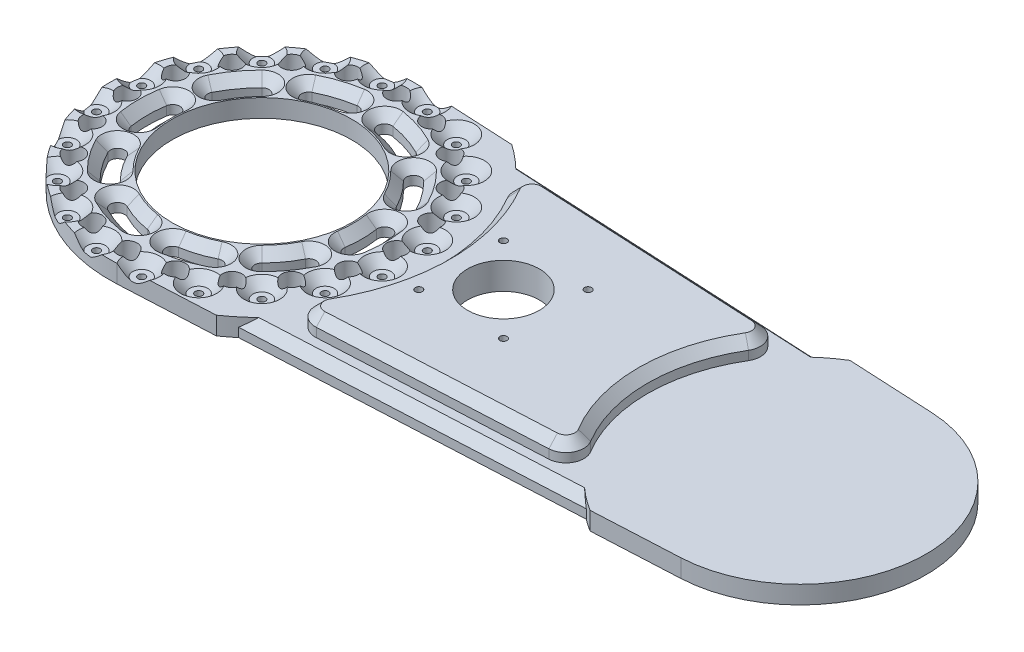
from build123d import *

# Parameters (mm, degrees)
BOSS_EXTRUDE3_OUTLINE_R   = 2
BOSS_EXTRUDE3_OUTLINE_R_2 = 5.5
BOSS_EXTRUDE3_OUTLINE_R_3 = 50
BOSS_EXTRUDE3_DEPTH       = 10
CUT_EXTRUDE1_DEPTH        = 10
SKETCH4_R                 = 5
CUT_EXTRUDE2_DEPTH        = 5
CHAMFER2_SIZE             = 5
SKETCH7_R                 = 2.000000006
SKETCH7_R_2               = 2.000000003
SKETCH7_R_3               = 2.000000005
SKETCH7_R_4               = 2.000000007
CUT_EXTRUDE4_DEPTH        = 15.5
CUT_EXTRUDE6_DEPTH        = 5
BOSS_EXTRUDE5_START       = 10
SKETCH10_R                = 20.000000001
SKETCH10_R_2              = 2.000000007
SKETCH10_R_3              = 2.000000006
SKETCH10_R_4              = 2.000000003
SKETCH10_R_5              = 2.000000005
BOSS_EXTRUDE5_DEPTH       = 10
CHAMFER3_SIZE             = 5
CUT_EXTRUDE7_DEPTH        = 10
CHAMFER5_SIZE             = 5


# Read off the part's stored shape, not the designer's step: Boss-Extrude3
with BuildPart() as part:
    # Boss-Extrude3 outline → Boss-Extrude3 (new body)
    with BuildSketch(Plane(origin=(0, 0, 0), x_dir=(1, 0, 0), z_dir=(0, 1, 0))):
        with BuildLine():
            ThreePointArc((303.24621879, -69.899132428), (369.740150323, 0.016046759), (303.240150389, 69.925453996))
            Line((303.240150389, 69.925453996), (4.25, 84.893683511))
            ThreePointArc((4.25, 84.893683511), (-84.99999992, -0.003689008), (4.257368772, -84.89331429))
            Line((4.257368772, -84.89331429), (303.24621879, -69.899132428))
        make_face()
        with Locations((-36.543122278, -71.72761124)):
            Circle(BOSS_EXTRUDE3_OUTLINE_R, mode=Mode.SUBTRACT)
        with Locations((-12.589523729, -79.509457879)):
            Circle(BOSS_EXTRUDE3_OUTLINE_R, mode=Mode.SUBTRACT)
        with Locations((0, -75)):
            Circle(BOSS_EXTRUDE3_OUTLINE_R_2, mode=Mode.SUBTRACT)
        with Locations((12.596425118, -79.508364807)):
            Circle(BOSS_EXTRUDE3_OUTLINE_R, mode=Mode.SUBTRACT)
        with Locations((-23.176274578, -71.329238722)):
            Circle(BOSS_EXTRUDE3_OUTLINE_R_2, mode=Mode.SUBTRACT)
        with Locations((23.176274578, -71.329238722)):
            Circle(BOSS_EXTRUDE3_OUTLINE_R_2, mode=Mode.SUBTRACT)
        with Locations((-56.919625407, -56.924566256)):
            Circle(BOSS_EXTRUDE3_OUTLINE_R, mode=Mode.SUBTRACT)
        with Locations((-44.083893922, -60.676274578)):
            Circle(BOSS_EXTRUDE3_OUTLINE_R_2, mode=Mode.SUBTRACT)
        with Locations((-60.676274578, -44.083893922)):
            Circle(BOSS_EXTRUDE3_OUTLINE_R_2, mode=Mode.SUBTRACT)
        with Locations((36.549348111, -71.724439019)):
            Circle(BOSS_EXTRUDE3_OUTLINE_R, mode=Mode.SUBTRACT)
        with Locations((44.083893922, -60.676274578)):
            Circle(BOSS_EXTRUDE3_OUTLINE_R_2, mode=Mode.SUBTRACT)
        with Locations((56.924566256, -56.919625407)):
            Circle(BOSS_EXTRUDE3_OUTLINE_R, mode=Mode.SUBTRACT)
        with Locations((60.676274578, -44.083893922)):
            Circle(BOSS_EXTRUDE3_OUTLINE_R_2, mode=Mode.SUBTRACT)
        with Locations((-71.724439019, -36.549348111)):
            Circle(BOSS_EXTRUDE3_OUTLINE_R, mode=Mode.SUBTRACT)
        with Locations((-71.329238722, -23.176274578)):
            Circle(BOSS_EXTRUDE3_OUTLINE_R_2, mode=Mode.SUBTRACT)
        with Locations((-79.508364807, -12.596425118)):
            Circle(BOSS_EXTRUDE3_OUTLINE_R, mode=Mode.SUBTRACT)
        with Locations((-75, 0)):
            Circle(BOSS_EXTRUDE3_OUTLINE_R_2, mode=Mode.SUBTRACT)
        Circle(BOSS_EXTRUDE3_OUTLINE_R_3, mode=Mode.SUBTRACT)
        with Locations((71.72761124, -36.543122278)):
            Circle(BOSS_EXTRUDE3_OUTLINE_R, mode=Mode.SUBTRACT)
        with Locations((71.329238722, -23.176274578)):
            Circle(BOSS_EXTRUDE3_OUTLINE_R_2, mode=Mode.SUBTRACT)
        with Locations((79.509457879, -12.589523729)):
            Circle(BOSS_EXTRUDE3_OUTLINE_R, mode=Mode.SUBTRACT)
        with Locations((75, 0)):
            Circle(BOSS_EXTRUDE3_OUTLINE_R_2, mode=Mode.SUBTRACT)
        with Locations((-79.509457879, 12.589523729)):
            Circle(BOSS_EXTRUDE3_OUTLINE_R, mode=Mode.SUBTRACT)
        with Locations((-71.329238722, 23.176274578)):
            Circle(BOSS_EXTRUDE3_OUTLINE_R_2, mode=Mode.SUBTRACT)
        with Locations((-71.72761124, 36.543122278)):
            Circle(BOSS_EXTRUDE3_OUTLINE_R, mode=Mode.SUBTRACT)
        with Locations((79.508364807, 12.596425118)):
            Circle(BOSS_EXTRUDE3_OUTLINE_R, mode=Mode.SUBTRACT)
        with Locations((71.329238722, 23.176274578)):
            Circle(BOSS_EXTRUDE3_OUTLINE_R_2, mode=Mode.SUBTRACT)
        with Locations((71.724439019, 36.549348111)):
            Circle(BOSS_EXTRUDE3_OUTLINE_R, mode=Mode.SUBTRACT)
        with Locations((-60.676274578, 44.083893922)):
            Circle(BOSS_EXTRUDE3_OUTLINE_R_2, mode=Mode.SUBTRACT)
        with Locations((-56.924566256, 56.919625407)):
            Circle(BOSS_EXTRUDE3_OUTLINE_R, mode=Mode.SUBTRACT)
        with Locations((-44.083893922, 60.676274578)):
            Circle(BOSS_EXTRUDE3_OUTLINE_R_2, mode=Mode.SUBTRACT)
        with Locations((-36.549348111, 71.724439019)):
            Circle(BOSS_EXTRUDE3_OUTLINE_R, mode=Mode.SUBTRACT)
        with Locations((-23.176274578, 71.329238722)):
            Circle(BOSS_EXTRUDE3_OUTLINE_R_2, mode=Mode.SUBTRACT)
        with Locations((23.176274578, 71.329238722)):
            Circle(BOSS_EXTRUDE3_OUTLINE_R_2, mode=Mode.SUBTRACT)
        with Locations((0, 75)):
            Circle(BOSS_EXTRUDE3_OUTLINE_R_2, mode=Mode.SUBTRACT)
        with Locations((-12.596425118, 79.508364807)):
            Circle(BOSS_EXTRUDE3_OUTLINE_R, mode=Mode.SUBTRACT)
        with Locations((12.589523729, 79.509457879)):
            Circle(BOSS_EXTRUDE3_OUTLINE_R, mode=Mode.SUBTRACT)
        with Locations((60.676274578, 44.083893922)):
            Circle(BOSS_EXTRUDE3_OUTLINE_R_2, mode=Mode.SUBTRACT)
        with Locations((56.919625407, 56.924566256)):
            Circle(BOSS_EXTRUDE3_OUTLINE_R, mode=Mode.SUBTRACT)
        with Locations((44.083893922, 60.676274578)):
            Circle(BOSS_EXTRUDE3_OUTLINE_R_2, mode=Mode.SUBTRACT)
        with Locations((36.543122278, 71.72761124)):
            Circle(BOSS_EXTRUDE3_OUTLINE_R, mode=Mode.SUBTRACT)
    extrude(amount=BOSS_EXTRUDE3_DEPTH)

    # Sketch3 → Cut-Extrude1 (cut)
    with BuildSketch(Plane(origin=(0, 10, 0), x_dir=(1, 0, 0), z_dir=(0, 1, 0))):
        with BuildLine():
            ThreePointArc((62.96556447, -9.969964444), (63.74999994, 0.002766756), (62.964698838, 9.97542983))
            ThreePointArc((62.964698838, 9.97542983), (58.388063313, 13.300246709), (55.063246434, 8.723611184))
            ThreePointArc((55.063246434, 8.723611184), (55.749999947, 0.002419555), (55.064003438, -8.718831651))
            ThreePointArc((55.064003438, -8.718831651), (58.389217557, -13.295178563), (62.96556447, -9.969964444))
        make_face()
        with BuildLine():
            ThreePointArc((56.800409782, 28.944359529), (51.573207084, 37.473548151), (45.076100866, 45.08001365))
            ThreePointArc((45.076100866, 45.08001365), (39.419246622, 45.079768142), (39.41949213, 39.422913898))
            ThreePointArc((39.41949213, 39.422913898), (45.101275215, 32.770985246), (49.672515222, 25.312126176))
            ThreePointArc((49.672515222, 25.312126176), (55.052579178, 23.564295572), (56.800409782, 28.944359529))
        make_face()
        with BuildLine():
            ThreePointArc((-9.97542983, 62.964698838), (-19.702464714, 60.628997882), (-28.944359529, 56.800409782))
            ThreePointArc((-28.944359529, 56.800409782), (-30.692190133, 51.420345826), (-25.312126176, 49.672515222))
            ThreePointArc((-25.312126176, 49.672515222), (-17.229998554, 53.02065305), (-8.723611184, 55.063246434))
            ThreePointArc((-8.723611184, 55.063246434), (-5.398794306, 59.639881959), (-9.97542983, 62.964698838))
        make_face()
        with BuildLine():
            ThreePointArc((45.08001365, -45.076100866), (51.576459601, -37.469071446), (56.802921945, -28.939429133))
            ThreePointArc((56.802921945, -28.939429133), (55.054624356, -23.559516909), (49.674712132, -25.307814497))
            ThreePointArc((49.674712132, -25.307814497), (45.104119573, -32.767070323), (39.422913898, -39.41949213))
            ThreePointArc((39.422913898, -39.41949213), (39.423159406, -45.076346374), (45.08001365, -45.076100866))
        make_face()
        with BuildLine():
            ThreePointArc((28.939429133, 56.802921945), (19.697202031, 60.630707831), (9.969964444, 62.96556447))
            ThreePointArc((9.969964444, 62.96556447), (5.393617532, 59.64035035), (8.718831651, 55.064003438))
            ThreePointArc((8.718831651, 55.064003438), (17.225396286, 53.022148417), (25.307814497, 49.674712132))
            ThreePointArc((25.307814497, 49.674712132), (30.687726721, 51.42300972), (28.939429133, 56.802921945))
        make_face()
        with BuildLine():
            ThreePointArc((-62.964698838, -9.97542983), (-58.388063313, -13.300246709), (-55.063246434, -8.723611184))
            ThreePointArc((-55.063246434, -8.723611184), (-55.749999947, -0.002419555), (-55.064003438, 8.718831651))
            ThreePointArc((-55.064003438, 8.718831651), (-58.389217557, 13.295178563), (-62.96556447, 9.969964444))
            ThreePointArc((-62.96556447, 9.969964444), (-63.74999994, -0.002766756), (-62.964698838, -9.97542983))
        make_face()
        with BuildLine():
            ThreePointArc((-56.802921945, 28.939429133), (-55.054624356, 23.559516909), (-49.674712132, 25.307814497))
            ThreePointArc((-49.674712132, 25.307814497), (-45.104119573, 32.767070323), (-39.422913898, 39.41949213))
            ThreePointArc((-39.422913898, 39.41949213), (-39.423159406, 45.076346374), (-45.08001365, 45.076100866))
            ThreePointArc((-45.08001365, 45.076100866), (-51.576459601, 37.469071446), (-56.802921945, 28.939429133))
        make_face()
        with BuildLine():
            ThreePointArc((-45.076100866, -45.08001365), (-39.419246622, -45.079768142), (-39.41949213, -39.422913898))
            ThreePointArc((-39.41949213, -39.422913898), (-45.101275215, -32.770985246), (-49.672515222, -25.312126176))
            ThreePointArc((-49.672515222, -25.312126176), (-55.052579178, -23.564295572), (-56.800409782, -28.944359529))
            ThreePointArc((-56.800409782, -28.944359529), (-51.573207084, -37.473548151), (-45.076100866, -45.08001365))
        make_face()
        with BuildLine():
            ThreePointArc((-25.307814497, -49.674712132), (-30.687726721, -51.42300972), (-28.939429133, -56.802921945))
            ThreePointArc((-28.939429133, -56.802921945), (-19.697202031, -60.630707831), (-9.969964444, -62.96556447))
            ThreePointArc((-9.969964444, -62.96556447), (-5.393617532, -59.64035035), (-8.718831651, -55.064003438))
            ThreePointArc((-8.718831651, -55.064003438), (-17.225396286, -53.022148417), (-25.307814497, -49.674712132))
        make_face()
        with BuildLine():
            ThreePointArc((8.723611184, -55.063246434), (5.398794306, -59.639881959), (9.97542983, -62.964698838))
            ThreePointArc((9.97542983, -62.964698838), (19.702464714, -60.628997882), (28.944359529, -56.800409782))
            ThreePointArc((28.944359529, -56.800409782), (30.692190133, -51.420345826), (25.312126176, -49.672515222))
            ThreePointArc((25.312126176, -49.672515222), (17.229998554, -53.02065305), (8.723611184, -55.063246434))
        make_face()
    extrude(amount=-CUT_EXTRUDE1_DEPTH, mode=Mode.SUBTRACT)

    # Sketch4 → Cut-Extrude2 (cut)
    with BuildSketch(Plane(origin=(0, 10, 0), x_dir=(1, 0, 0), z_dir=(0, 1, 0))):
        with Locations((-79.508364807, -12.596425118)):
            Circle(SKETCH4_R)
        with Locations((-79.509457879, 12.589523729)):
            Circle(SKETCH4_R)
        with Locations((-71.72761124, 36.543122278)):
            Circle(SKETCH4_R)
        with Locations((-56.924566256, 56.919625407)):
            Circle(SKETCH4_R)
        with Locations((-36.549348111, 71.724439019)):
            Circle(SKETCH4_R)
        with Locations((-12.596425118, 79.508364807)):
            Circle(SKETCH4_R)
        with Locations((12.589523729, 79.509457879)):
            Circle(SKETCH4_R)
        with Locations(Location((36.543122278, 71.72761124, 0), (0, 0, 270))):
            Circle(SKETCH4_R)
        with Locations(Location((56.919625407, 56.924566256, 0), (0, 0, 270))):
            Circle(SKETCH4_R)
        with Locations(Location((71.724439019, 36.549348111, 0), (0, 0, 270))):
            Circle(SKETCH4_R)
        with Locations(Location((79.508364807, 12.596425118, 0), (0, 0, 270))):
            Circle(SKETCH4_R)
        with Locations(Location((79.509457879, -12.589523729, 0), (0, 0, 270))):
            Circle(SKETCH4_R)
        with Locations(Location((71.72761124, -36.543122278, 0), (0, 0, 270))):
            Circle(SKETCH4_R)
        with Locations(Location((56.924566256, -56.919625407, 0), (0, 0, 270))):
            Circle(SKETCH4_R)
        with Locations(Location((36.549348111, -71.724439019, 0), (0, 0, 270))):
            Circle(SKETCH4_R)
        with Locations((12.596425118, -79.508364807)):
            Circle(SKETCH4_R)
        with Locations((-12.589523729, -79.509457879)):
            Circle(SKETCH4_R)
        with Locations((-36.543122278, -71.72761124)):
            Circle(SKETCH4_R)
        with Locations((-56.919625407, -56.924566256)):
            Circle(SKETCH4_R)
        with Locations((-71.724439019, -36.549348111)):
            Circle(SKETCH4_R)
    extrude(amount=-CUT_EXTRUDE2_DEPTH, mode=Mode.SUBTRACT)

    # Chamfer2
    # the kernel refuses this chamfer: 5 mm, written as the material it takes off along each edge
    with BuildSketch(Plane(origin=(-59.013972636, 10, 9.349520507), x_dir=(-0.987681550393962, 0, 0.15647733066287803), z_dir=(-0.15647733066287803, 0, -0.987681550393962))) as chamfer2_piece_1:
        Polygon((4 + CHAMFER2_SIZE, 0), (4, -CHAMFER2_SIZE), (4, 0), align=None)
    revolve(axis=Axis((-59.013972636, 10, 9.349520507), (0, 1, 0)), revolution_arc=180, mode=Mode.SUBTRACT)
    with BuildSketch(Plane(origin=(0, 10, 0), x_dir=(-0.9876815503939634, 0, 0.156477330662869), z_dir=(0.156477330662869, 0, 0.9876815503939634))) as chamfer2_piece_2:
        Polygon((55.75 - CHAMFER2_SIZE, 0), (55.75, CHAMFER2_SIZE), (55.75, 0), align=None)
    revolve(axis=Axis((0, 10, 0), (0, -1, 0)), revolution_arc=18, mode=Mode.SUBTRACT)
    with BuildSketch(Plane(origin=(0, 10, 0), x_dir=(-0.9876951289359334, 0, -0.1563915991229388), z_dir=(0.1563915991229388, 0, -0.9876951289359334))) as chamfer2_piece_3:
        Polygon((63.75 + CHAMFER2_SIZE, 0), (63.75, -CHAMFER2_SIZE), (63.75, 0), align=None)
    revolve(axis=Axis((0, 10, 0), (0, 1, 0)), revolution_arc=18, mode=Mode.SUBTRACT)
    with BuildSketch(Plane(origin=(-59.014783954, 10, -9.344398048), x_dir=(0.9876951289359372, 0, 0.15639159912291412), z_dir=(-0.15639159912291412, 0, 0.9876951289359372))) as chamfer2_piece_4:
        Polygon((4 + CHAMFER2_SIZE, 0), (4, -CHAMFER2_SIZE), (4, 0), align=None)
    revolve(axis=Axis((-59.014783954, 10, -9.344398048), (0, 1, 0)), revolution_arc=180, mode=Mode.SUBTRACT)
    with BuildSketch(Plane(origin=(-42.247796498, 10, 42.251463774), x_dir=(-0.707076092017545, 0, 0.707137469023666), z_dir=(-0.707137469023666, 0, -0.707076092017545))) as chamfer2_piece_5:
        Polygon((4 + CHAMFER2_SIZE, 0), (4, -CHAMFER2_SIZE), (4, 0), align=None)
    revolve(axis=Axis((-42.247796498, 10, 42.251463774), (0, 1, 0)), revolution_arc=180, mode=Mode.SUBTRACT)
    with BuildSketch(Plane(origin=(0, 10, 0), x_dir=(-0.7070760920176004, 0, 0.7071374690236107), z_dir=(0.7071374690236107, 0, 0.7070760920176004))) as chamfer2_piece_6:
        Polygon((55.75 - CHAMFER2_SIZE, 0), (55.75, CHAMFER2_SIZE), (55.75, 0), align=None)
    revolve(axis=Axis((0, 10, 0), (0, -1, 0)), revolution_arc=18, mode=Mode.SUBTRACT)
    with BuildSketch(Plane(origin=(0, 10, 0), x_dir=(-0.8909868201174173, 0, 0.45402916908173774), z_dir=(-0.45402916908173774, 0, -0.8909868201174173))) as chamfer2_piece_7:
        Polygon((63.75 + CHAMFER2_SIZE, 0), (63.75, -CHAMFER2_SIZE), (63.75, 0), align=None)
    revolve(axis=Axis((0, 10, 0), (0, 1, 0)), revolution_arc=18, mode=Mode.SUBTRACT)
    with BuildSketch(Plane(origin=(-53.236462502, 10, 27.128242853), x_dir=(0.8909868201174534, 0, -0.4540291690816666), z_dir=(0.4540291690816666, 0, 0.8909868201174534))) as chamfer2_piece_8:
        Polygon((4 + CHAMFER2_SIZE, 0), (4, -CHAMFER2_SIZE), (4, 0), align=None)
    revolve(axis=Axis((-53.236462502, 10, 27.128242853), (0, 1, 0)), revolution_arc=180, mode=Mode.SUBTRACT)
    with BuildSketch(Plane(origin=(-9.344398048, 10, 59.014783954), x_dir=(-0.15639159912293782, 0, 0.9876951289359336), z_dir=(-0.9876951289359336, 0, -0.15639159912293782))) as chamfer2_piece_9:
        Polygon((4 + CHAMFER2_SIZE, 0), (4, -CHAMFER2_SIZE), (4, 0), align=None)
    revolve(axis=Axis((-9.344398048, 10, 59.014783954), (0, 1, 0)), revolution_arc=180, mode=Mode.SUBTRACT)
    with BuildSketch(Plane(origin=(0, 10, 0), x_dir=(-0.156391599122972, 0, 0.9876951289359281), z_dir=(0.9876951289359281, 0, 0.156391599122972))) as chamfer2_piece_10:
        Polygon((55.75 - CHAMFER2_SIZE, 0), (55.75, CHAMFER2_SIZE), (55.75, 0), align=None)
    revolve(axis=Axis((0, 10, 0), (0, -1, 0)), revolution_arc=18, mode=Mode.SUBTRACT)
    with BuildSketch(Plane(origin=(0, 10, 0), x_dir=(-0.45395182954222274, 0, 0.8910262265810523), z_dir=(-0.8910262265810523, 0, -0.45395182954222274))) as chamfer2_piece_11:
        Polygon((63.75 + CHAMFER2_SIZE, 0), (63.75, -CHAMFER2_SIZE), (63.75, 0), align=None)
    revolve(axis=Axis((0, 10, 0), (0, 1, 0)), revolution_arc=18, mode=Mode.SUBTRACT)
    with BuildSketch(Plane(origin=(-27.123621815, 10, 53.238817038), x_dir=(0.45395182954229385, 0, -0.891026226581016), z_dir=(0.891026226581016, 0, 0.45395182954229385))) as chamfer2_piece_12:
        Polygon((4 + CHAMFER2_SIZE, 0), (4, -CHAMFER2_SIZE), (4, 0), align=None)
    revolve(axis=Axis((-27.123621815, 10, 53.238817038), (0, 1, 0)), revolution_arc=180, mode=Mode.SUBTRACT)
    with BuildSketch(Plane(origin=(9.349520507, 10, 59.013972636), x_dir=(-0.1564773306628907, 0, -0.98768155039396), z_dir=(0.98768155039396, 0, -0.1564773306628907))) as chamfer2_piece_13:
        Polygon((4 + CHAMFER2_SIZE, 0), (4, -CHAMFER2_SIZE), (4, 0), align=None)
    revolve(axis=Axis((9.349520507, 10, 59.013972636), (0, 1, 0)), revolution_arc=180, mode=Mode.SUBTRACT)
    with BuildSketch(Plane(origin=(0, 10, 0), x_dir=(0.1564773306628972, 0, 0.9876815503939589), z_dir=(-0.9876815503939589, 0, 0.1564773306628972))) as chamfer2_piece_14:
        Polygon((63.75 + CHAMFER2_SIZE, 0), (63.75, -CHAMFER2_SIZE), (63.75, 0), align=None)
    revolve(axis=Axis((0, 10, 0), (0, 1, 0)), revolution_arc=18, mode=Mode.SUBTRACT)
    with BuildSketch(Plane(origin=(0, 10, 0), x_dir=(0.4540291690816931, 0, 0.89098682011744), z_dir=(0.89098682011744, 0, -0.4540291690816931))) as chamfer2_piece_15:
        Polygon((55.75 - CHAMFER2_SIZE, 0), (55.75, CHAMFER2_SIZE), (55.75, 0), align=None)
    revolve(axis=Axis((0, 10, 0), (0, -1, 0)), revolution_arc=18, mode=Mode.SUBTRACT)
    with BuildSketch(Plane(origin=(27.128242853, 10, 53.236462502), x_dir=(0.45402916908164603, 0, 0.890986820117464), z_dir=(-0.890986820117464, 0, 0.45402916908164603))) as chamfer2_piece_16:
        Polygon((4 + CHAMFER2_SIZE, 0), (4, -CHAMFER2_SIZE), (4, 0), align=None)
    revolve(axis=Axis((27.128242853, 10, 53.236462502), (0, 1, 0)), revolution_arc=180, mode=Mode.SUBTRACT)
    with BuildSketch(Plane(origin=(42.251463774, 10, 42.247796498), x_dir=(-0.7071374690237141, 0, -0.7070760920174971), z_dir=(0.7070760920174971, 0, -0.7071374690237141))) as chamfer2_piece_17:
        Polygon((4 + CHAMFER2_SIZE, 0), (4, -CHAMFER2_SIZE), (4, 0), align=None)
    revolve(axis=Axis((42.251463774, 10, 42.247796498), (0, 1, 0)), revolution_arc=180, mode=Mode.SUBTRACT)
    with BuildSketch(Plane(origin=(0, 10, 0), x_dir=(0.7071374690236412, 0, 0.7070760920175699), z_dir=(-0.7070760920175699, 0, 0.7071374690236412))) as chamfer2_piece_18:
        Polygon((63.75 + CHAMFER2_SIZE, 0), (63.75, -CHAMFER2_SIZE), (63.75, 0), align=None)
    revolve(axis=Axis((0, 10, 0), (0, 1, 0)), revolution_arc=18, mode=Mode.SUBTRACT)
    with BuildSketch(Plane(origin=(0, 10, 0), x_dir=(0.8910262265810269, 0, 0.4539518295422725), z_dir=(0.4539518295422725, 0, -0.8910262265810269))) as chamfer2_piece_19:
        Polygon((55.75 - CHAMFER2_SIZE, 0), (55.75, CHAMFER2_SIZE), (55.75, 0), align=None)
    revolve(axis=Axis((0, 10, 0), (0, -1, 0)), revolution_arc=18, mode=Mode.SUBTRACT)
    with BuildSketch(Plane(origin=(53.238817038, 10, 27.123621815), x_dir=(0.8910262265809425, 0, 0.4539518295424383), z_dir=(-0.4539518295424383, 0, 0.8910262265809425))) as chamfer2_piece_20:
        Polygon((4 + CHAMFER2_SIZE, 0), (4, -CHAMFER2_SIZE), (4, 0), align=None)
    revolve(axis=Axis((53.238817038, 10, 27.123621815), (0, 1, 0)), revolution_arc=180, mode=Mode.SUBTRACT)
    with BuildSketch(Plane(origin=(59.014783954, 10, 9.344398048), x_dir=(-0.9876951289359776, 0, -0.15639159912265974), z_dir=(0.15639159912265974, 0, -0.9876951289359776))) as chamfer2_piece_21:
        Polygon((4 + CHAMFER2_SIZE, 0), (4, -CHAMFER2_SIZE), (4, 0), align=None)
    revolve(axis=Axis((59.014783954, 10, 9.344398048), (0, 1, 0)), revolution_arc=180, mode=Mode.SUBTRACT)
    with BuildSketch(Plane(origin=(0, 10, 0), x_dir=(0.9876951289359344, 0, 0.15639159912293288), z_dir=(-0.15639159912293288, 0, 0.9876951289359344))) as chamfer2_piece_22:
        Polygon((63.75 + CHAMFER2_SIZE, 0), (63.75, -CHAMFER2_SIZE), (63.75, 0), align=None)
    revolve(axis=Axis((0, 10, 0), (0, 1, 0)), revolution_arc=18, mode=Mode.SUBTRACT)
    with BuildSketch(Plane(origin=(0, 10, 0), x_dir=(0.9876815503939652, 0, -0.15647733066285652), z_dir=(-0.15647733066285652, 0, -0.9876815503939652))) as chamfer2_piece_23:
        Polygon((55.75 - CHAMFER2_SIZE, 0), (55.75, CHAMFER2_SIZE), (55.75, 0), align=None)
    revolve(axis=Axis((0, 10, 0), (0, -1, 0)), revolution_arc=18, mode=Mode.SUBTRACT)
    with BuildSketch(Plane(origin=(59.013972636, 10, -9.349520507), x_dir=(0.9876815503940178, 0, -0.15647733066252528), z_dir=(0.15647733066252528, 0, 0.9876815503940178))) as chamfer2_piece_24:
        Polygon((4 + CHAMFER2_SIZE, 0), (4, -CHAMFER2_SIZE), (4, 0), align=None)
    revolve(axis=Axis((59.013972636, 10, -9.349520507), (0, 1, 0)), revolution_arc=180, mode=Mode.SUBTRACT)
    with BuildSketch(Plane(origin=(53.236462502, 10, -27.128242853), x_dir=(-0.8909868201172598, 0, 0.45402916908204666), z_dir=(-0.45402916908204666, 0, -0.8909868201172598))) as chamfer2_piece_25:
        Polygon((4 + CHAMFER2_SIZE, 0), (4, -CHAMFER2_SIZE), (4, 0), align=None)
    revolve(axis=Axis((53.236462502, 10, -27.128242853), (0, 1, 0)), revolution_arc=180, mode=Mode.SUBTRACT)
    with BuildSketch(Plane(origin=(0, 10, 0), x_dir=(0.8909868201174278, 0, -0.45402916908171703), z_dir=(0.45402916908171703, 0, 0.8909868201174278))) as chamfer2_piece_26:
        Polygon((63.75 + CHAMFER2_SIZE, 0), (63.75, -CHAMFER2_SIZE), (63.75, 0), align=None)
    revolve(axis=Axis((0, 10, 0), (0, 1, 0)), revolution_arc=18, mode=Mode.SUBTRACT)
    with BuildSketch(Plane(origin=(0, 10, 0), x_dir=(0.7070760920175798, 0, -0.7071374690236313), z_dir=(-0.7071374690236313, 0, -0.7070760920175798))) as chamfer2_piece_27:
        Polygon((55.75 - CHAMFER2_SIZE, 0), (55.75, CHAMFER2_SIZE), (55.75, 0), align=None)
    revolve(axis=Axis((0, 10, 0), (0, -1, 0)), revolution_arc=18, mode=Mode.SUBTRACT)
    with BuildSketch(Plane(origin=(42.247796498, 10, -42.251463774), x_dir=(0.7070760920178728, 0, -0.7071374690233384), z_dir=(0.7071374690233384, 0, 0.7070760920178728))) as chamfer2_piece_28:
        Polygon((4 + CHAMFER2_SIZE, 0), (4, -CHAMFER2_SIZE), (4, 0), align=None)
    revolve(axis=Axis((42.247796498, 10, -42.251463774), (0, 1, 0)), revolution_arc=180, mode=Mode.SUBTRACT)
    with BuildSketch(Plane(origin=(27.123621815, 10, -53.238817038), x_dir=(-0.45395182954191593, 0, 0.8910262265812087), z_dir=(-0.8910262265812087, 0, -0.45395182954191593))) as chamfer2_piece_29:
        Polygon((4 + CHAMFER2_SIZE, 0), (4, -CHAMFER2_SIZE), (4, 0), align=None)
    revolve(axis=Axis((27.123621815, 10, -53.238817038), (0, 1, 0)), revolution_arc=180, mode=Mode.SUBTRACT)
    with BuildSketch(Plane(origin=(0, 10, 0), x_dir=(0.45395182954226415, 0, -0.8910262265810311), z_dir=(0.8910262265810311, 0, 0.45395182954226415))) as chamfer2_piece_30:
        Polygon((63.75 + CHAMFER2_SIZE, 0), (63.75, -CHAMFER2_SIZE), (63.75, 0), align=None)
    revolve(axis=Axis((0, 10, 0), (0, 1, 0)), revolution_arc=18, mode=Mode.SUBTRACT)
    with BuildSketch(Plane(origin=(0, 10, 0), x_dir=(0.15639159912291864, 0, -0.9876951289359365), z_dir=(-0.9876951289359365, 0, -0.15639159912291864))) as chamfer2_piece_31:
        Polygon((55.75 - CHAMFER2_SIZE, 0), (55.75, CHAMFER2_SIZE), (55.75, 0), align=None)
    revolve(axis=Axis((0, 10, 0), (0, -1, 0)), revolution_arc=18, mode=Mode.SUBTRACT)
    with BuildSketch(Plane(origin=(9.344398048, 10, -59.014783954), x_dir=(0.1563915991233011, 0, -0.987695128935876), z_dir=(0.987695128935876, 0, 0.1563915991233011))) as chamfer2_piece_32:
        Polygon((4 + CHAMFER2_SIZE, 0), (4, -CHAMFER2_SIZE), (4, 0), align=None)
    revolve(axis=Axis((9.344398048, 10, -59.014783954), (0, 1, 0)), revolution_arc=180, mode=Mode.SUBTRACT)
    with BuildSketch(Plane(origin=(-9.349520507, 10, -59.013972636), x_dir=(0.15647733066316172, 0, 0.987681550393917), z_dir=(-0.987681550393917, 0, 0.15647733066316172))) as chamfer2_piece_33:
        Polygon((4 + CHAMFER2_SIZE, 0), (4, -CHAMFER2_SIZE), (4, 0), align=None)
    revolve(axis=Axis((-9.349520507, 10, -59.013972636), (0, 1, 0)), revolution_arc=180, mode=Mode.SUBTRACT)
    with BuildSketch(Plane(origin=(0, 10, 0), x_dir=(-0.15647733066284794, 0, -0.9876815503939667), z_dir=(0.9876815503939667, 0, -0.15647733066284794))) as chamfer2_piece_34:
        Polygon((63.75 + CHAMFER2_SIZE, 0), (63.75, -CHAMFER2_SIZE), (63.75, 0), align=None)
    revolve(axis=Axis((0, 10, 0), (0, 1, 0)), revolution_arc=18, mode=Mode.SUBTRACT)
    with BuildSketch(Plane(origin=(0, 10, 0), x_dir=(-0.45402916908174695, 0, -0.8909868201174126), z_dir=(-0.8909868201174126, 0, 0.45402916908174695))) as chamfer2_piece_35:
        Polygon((55.75 - CHAMFER2_SIZE, 0), (55.75, CHAMFER2_SIZE), (55.75, 0), align=None)
    revolve(axis=Axis((0, 10, 0), (0, -1, 0)), revolution_arc=18, mode=Mode.SUBTRACT)
    with BuildSketch(Plane(origin=(-27.128242853, 10, -53.236462502), x_dir=(-0.4540291690814938, 0, -0.8909868201175415), z_dir=(0.8909868201175415, 0, -0.4540291690814938))) as chamfer2_piece_36:
        Polygon((4 + CHAMFER2_SIZE, 0), (4, -CHAMFER2_SIZE), (4, 0), align=None)
    revolve(axis=Axis((-27.128242853, 10, -53.236462502), (0, 1, 0)), revolution_arc=180, mode=Mode.SUBTRACT)
    with BuildSketch(Plane(origin=(-53.238817038, 10, -27.123621815), x_dir=(-0.8910262265809897, 0, -0.45395182954234553), z_dir=(0.45395182954234553, 0, -0.8910262265809897))) as chamfer2_piece_37:
        Polygon((4 + CHAMFER2_SIZE, 0), (4, -CHAMFER2_SIZE), (4, 0), align=None)
    revolve(axis=Axis((-53.238817038, 10, -27.123621815), (0, 1, 0)), revolution_arc=180, mode=Mode.SUBTRACT)
    with BuildSketch(Plane(origin=(0, 10, 0), x_dir=(-0.8910262265810451, 0, -0.4539518295422369), z_dir=(-0.4539518295422369, 0, 0.8910262265810451))) as chamfer2_piece_38:
        Polygon((55.75 - CHAMFER2_SIZE, 0), (55.75, CHAMFER2_SIZE), (55.75, 0), align=None)
    revolve(axis=Axis((0, 10, 0), (0, -1, 0)), revolution_arc=18, mode=Mode.SUBTRACT)
    with BuildSketch(Plane(origin=(0, 10, 0), x_dir=(-0.7071374690236155, 0, -0.7070760920175956), z_dir=(0.7070760920175956, 0, -0.7071374690236155))) as chamfer2_piece_39:
        Polygon((63.75 + CHAMFER2_SIZE, 0), (63.75, -CHAMFER2_SIZE), (63.75, 0), align=None)
    revolve(axis=Axis((0, 10, 0), (0, 1, 0)), revolution_arc=18, mode=Mode.SUBTRACT)
    with BuildSketch(Plane(origin=(-42.251463774, 10, -42.247796498), x_dir=(0.7071374690237363, 0, 0.7070760920174749), z_dir=(-0.7070760920174749, 0, 0.7071374690237363))) as chamfer2_piece_40:
        Polygon((4 + CHAMFER2_SIZE, 0), (4, -CHAMFER2_SIZE), (4, 0), align=None)
    revolve(axis=Axis((-42.251463774, 10, -42.247796498), (0, 1, 0)), revolution_arc=180, mode=Mode.SUBTRACT)
    with BuildSketch(Plane(origin=(-79.508364807, 10, 12.596425118), x_dir=(-0.9881682636084103, 0, 0.15337367048205947), z_dir=(0.15337367048205947, 0, 0.9881682636084103))) as chamfer2_piece_41_section:
        Polygon((5, CHAMFER2_SIZE), (5 + CHAMFER2_SIZE, 0), (5, 0), align=None)
    chamfer2_piece_41 = revolve(axis=Axis((-79.508364807, 10, 12.596425118), (0, -1, 0)), revolution_arc=359.64, mode=Mode.PRIVATE)
    chamfer2_piece_41 = split(chamfer2_piece_41, bisect_by=Plane(origin=(-72.088934145, 5, 11.420972661), z_dir=(0, 1, 0)), keep=Keep.TOP, mode=Mode.PRIVATE)
    add(chamfer2_piece_41, mode=Mode.SUBTRACT)
    with BuildSketch(Plane(origin=(-71.724439019, 10, 36.549348111), x_dir=(-0.8924087956325404, 0, 0.45122781549642826), z_dir=(0.45122781549642826, 0, 0.8924087956325404))) as chamfer2_piece_42_section:
        Polygon((5, CHAMFER2_SIZE), (5 + CHAMFER2_SIZE, 0), (5, 0), align=None)
    chamfer2_piece_42 = revolve(axis=Axis((-71.724439019, 10, 36.549348111), (0, -1, 0)), revolution_arc=359.64, mode=Mode.PRIVATE)
    chamfer2_piece_42 = split(chamfer2_piece_42, bisect_by=Plane(origin=(-65.031375926, 5, 33.138696229), z_dir=(0, 1, 0)), keep=Keep.TOP, mode=Mode.PRIVATE)
    add(chamfer2_piece_42, mode=Mode.SUBTRACT)
    with BuildSketch(Plane(origin=(-56.919625407, 10, 56.924566256), x_dir=(-0.7092941369629903, 0, 0.7049126380410035), z_dir=(0.7049126380410035, 0, 0.7092941369629903))) as chamfer2_piece_43_section:
        Polygon((5, CHAMFER2_SIZE), (5 + CHAMFER2_SIZE, 0), (5, 0), align=None)
    chamfer2_piece_43 = revolve(axis=Axis((-56.919625407, 10, 56.924566256), (0, -1, 0)), revolution_arc=359.64, mode=Mode.PRIVATE)
    chamfer2_piece_43 = split(chamfer2_piece_43, bisect_by=Plane(origin=(-51.608093532, 5, 51.612573319), z_dir=(0, 1, 0)), keep=Keep.TOP, mode=Mode.PRIVATE)
    add(chamfer2_piece_43, mode=Mode.SUBTRACT)
    with BuildSketch(Plane(origin=(-36.543122278, 10, 71.72761124), x_dir=(-0.45674882622506047, 0, 0.8895957001593642), z_dir=(0.8895957001593642, 0, 0.45674882622506047))) as chamfer2_piece_44_section:
        Polygon((5, CHAMFER2_SIZE), (5 + CHAMFER2_SIZE, 0), (5, 0), align=None)
    chamfer2_piece_44 = revolve(axis=Axis((-36.543122278, 10, 71.72761124), (0, -1, 0)), revolution_arc=359.64, mode=Mode.PRIVATE)
    chamfer2_piece_44 = split(chamfer2_piece_44, bisect_by=Plane(origin=(-33.133051368, 5, 65.034252127), z_dir=(0, 1, 0)), keep=Keep.TOP, mode=Mode.PRIVATE)
    add(chamfer2_piece_44, mode=Mode.SUBTRACT)
    with BuildSketch(Plane(origin=(-12.589523729, 10, 79.509457879), x_dir=(-0.15949375802021026, 0, 0.9871989369689326), z_dir=(0.9871989369689326, 0, 0.15949375802021026))) as chamfer2_piece_45_section:
        Polygon((5, CHAMFER2_SIZE), (5 + CHAMFER2_SIZE, 0), (5, 0), align=None)
    chamfer2_piece_45 = revolve(axis=Axis((-12.589523729, 10, 79.509457879), (0, -1, 0)), revolution_arc=359.64, mode=Mode.PRIVATE)
    chamfer2_piece_45 = split(chamfer2_piece_45, bisect_by=Plane(origin=(-11.414715285, 5, 72.089925216), z_dir=(0, 1, 0)), keep=Keep.TOP, mode=Mode.PRIVATE)
    add(chamfer2_piece_45, mode=Mode.SUBTRACT)
    with BuildSketch(Plane(origin=(12.596425118, 10, 79.508364807), x_dir=(0.04694879987333268, 0, 0.9988972971184044), z_dir=(0.9988972971184044, 0, -0.04694879987333268))) as chamfer2_piece_46_section:
        Polygon((5, CHAMFER2_SIZE), (5 + CHAMFER2_SIZE, 0), (5, 0), align=None)
    chamfer2_piece_46 = revolve(axis=Axis((12.596425118, 10, 79.508364807), (0, -1, 0)), revolution_arc=359.64, mode=Mode.PRIVATE)
    chamfer2_piece_46 = split(chamfer2_piece_46, bisect_by=Plane(origin=(12.220175573, 5, 72.005826829), z_dir=(0, 1, 0)), keep=Keep.TOP, mode=Mode.PRIVATE)
    add(chamfer2_piece_46, mode=Mode.SUBTRACT)
    with BuildSketch(Plane(origin=(36.549348111, 10, 71.724439019), x_dir=(0, 0, 1), z_dir=(-1, 0, 0))) as chamfer2_piece_47_section:
        Polygon((5 + CHAMFER2_SIZE, 0), (5, -CHAMFER2_SIZE), (5, 0), align=None)
    chamfer2_piece_47 = revolve(axis=Axis((36.549348111, 10, 71.724439019), (0, 1, 0)), mode=Mode.PRIVATE)
    chamfer2_piece_47 = split(chamfer2_piece_47, bisect_by=Plane(origin=(36.549348111, 5, 64.212492171), z_dir=(0, 1, 0)), keep=Keep.TOP, mode=Mode.PRIVATE)
    add(chamfer2_piece_47, mode=Mode.SUBTRACT)
    with BuildSketch(Plane(origin=(56.924566256, 10, 56.919625407), x_dir=(0, 0, 1), z_dir=(-1, 0, 0))) as chamfer2_piece_48_section:
        Polygon((5 + CHAMFER2_SIZE, 0), (5, -CHAMFER2_SIZE), (5, 0), align=None)
    chamfer2_piece_48 = revolve(axis=Axis((56.924566256, 10, 56.919625407), (0, 1, 0)), mode=Mode.PRIVATE)
    chamfer2_piece_48 = split(chamfer2_piece_48, bisect_by=Plane(origin=(56.924566256, 5, 49.407678559), z_dir=(0, 1, 0)), keep=Keep.TOP, mode=Mode.PRIVATE)
    add(chamfer2_piece_48, mode=Mode.SUBTRACT)
    with BuildSketch(Plane(origin=(71.72761124, 10, 36.543122278), x_dir=(0, 0, 1), z_dir=(-1, 0, 0))) as chamfer2_piece_49_section:
        Polygon((5 + CHAMFER2_SIZE, 0), (5, -CHAMFER2_SIZE), (5, 0), align=None)
    chamfer2_piece_49 = revolve(axis=Axis((71.72761124, 10, 36.543122278), (0, 1, 0)), mode=Mode.PRIVATE)
    chamfer2_piece_49 = split(chamfer2_piece_49, bisect_by=Plane(origin=(71.72761124, 5, 29.03117543), z_dir=(0, 1, 0)), keep=Keep.TOP, mode=Mode.PRIVATE)
    add(chamfer2_piece_49, mode=Mode.SUBTRACT)
    with BuildSketch(Plane(origin=(79.509457879, 10, 12.589523729), x_dir=(0, 0, 1), z_dir=(-1, 0, 0))) as chamfer2_piece_50_section:
        Polygon((5 + CHAMFER2_SIZE, 0), (5, -CHAMFER2_SIZE), (5, 0), align=None)
    chamfer2_piece_50 = revolve(axis=Axis((79.509457879, 10, 12.589523729), (0, 1, 0)), mode=Mode.PRIVATE)
    chamfer2_piece_50 = split(chamfer2_piece_50, bisect_by=Plane(origin=(79.509457879, 5, 5.077576883), z_dir=(0, 1, 0)), keep=Keep.TOP, mode=Mode.PRIVATE)
    add(chamfer2_piece_50, mode=Mode.SUBTRACT)
    with BuildSketch(Plane(origin=(79.508364807, 10, -12.596425118), x_dir=(0, 0, 1), z_dir=(-1, 0, 0))) as chamfer2_piece_51_section:
        Polygon((5 + CHAMFER2_SIZE, 0), (5, -CHAMFER2_SIZE), (5, 0), align=None)
    chamfer2_piece_51 = revolve(axis=Axis((79.508364807, 10, -12.596425118), (0, 1, 0)), mode=Mode.PRIVATE)
    chamfer2_piece_51 = split(chamfer2_piece_51, bisect_by=Plane(origin=(79.508364807, 5, -20.108371965), z_dir=(0, 1, 0)), keep=Keep.TOP, mode=Mode.PRIVATE)
    add(chamfer2_piece_51, mode=Mode.SUBTRACT)
    with BuildSketch(Plane(origin=(71.724439019, 10, -36.549348111), x_dir=(0, 0, 1), z_dir=(-1, 0, 0))) as chamfer2_piece_52_section:
        Polygon((5 + CHAMFER2_SIZE, 0), (5, -CHAMFER2_SIZE), (5, 0), align=None)
    chamfer2_piece_52 = revolve(axis=Axis((71.724439019, 10, -36.549348111), (0, 1, 0)), mode=Mode.PRIVATE)
    chamfer2_piece_52 = split(chamfer2_piece_52, bisect_by=Plane(origin=(71.724439019, 5, -44.061294957), z_dir=(0, 1, 0)), keep=Keep.TOP, mode=Mode.PRIVATE)
    add(chamfer2_piece_52, mode=Mode.SUBTRACT)
    with BuildSketch(Plane(origin=(56.919625407, 10, -56.924566256), x_dir=(0, 0, 1), z_dir=(-1, 0, 0))) as chamfer2_piece_53_section:
        Polygon((5 + CHAMFER2_SIZE, 0), (5, -CHAMFER2_SIZE), (5, 0), align=None)
    chamfer2_piece_53 = revolve(axis=Axis((56.919625407, 10, -56.924566256), (0, 1, 0)), mode=Mode.PRIVATE)
    chamfer2_piece_53 = split(chamfer2_piece_53, bisect_by=Plane(origin=(56.919625407, 5, -64.436513103), z_dir=(0, 1, 0)), keep=Keep.TOP, mode=Mode.PRIVATE)
    add(chamfer2_piece_53, mode=Mode.SUBTRACT)
    with BuildSketch(Plane(origin=(36.543122278, 10, -71.72761124), x_dir=(0, 0, 1), z_dir=(-1, 0, 0))) as chamfer2_piece_54_section:
        Polygon((5 + CHAMFER2_SIZE, 0), (5, -CHAMFER2_SIZE), (5, 0), align=None)
    chamfer2_piece_54 = revolve(axis=Axis((36.543122278, 10, -71.72761124), (0, 1, 0)), mode=Mode.PRIVATE)
    chamfer2_piece_54 = split(chamfer2_piece_54, bisect_by=Plane(origin=(36.543122278, 5, -79.239558086), z_dir=(0, 1, 0)), keep=Keep.TOP, mode=Mode.PRIVATE)
    add(chamfer2_piece_54, mode=Mode.SUBTRACT)
    with BuildSketch(Plane(origin=(12.589523729, 10, -79.509457879), x_dir=(0.053137411304434605, 0, -0.9985872097718171), z_dir=(-0.9985872097718171, 0, -0.053137411304434605))) as chamfer2_piece_55_section:
        Polygon((5, CHAMFER2_SIZE), (5 + CHAMFER2_SIZE, 0), (5, 0), align=None)
    chamfer2_piece_55 = revolve(axis=Axis((12.589523729, 10, -79.509457879), (0, -1, 0)), revolution_arc=359.64, mode=Mode.PRIVATE)
    chamfer2_piece_55 = split(chamfer2_piece_55, bisect_by=Plane(origin=(12.213925407, 5, -72.006887271), z_dir=(0, 1, 0)), keep=Keep.TOP, mode=Mode.PRIVATE)
    add(chamfer2_piece_55, mode=Mode.SUBTRACT)
    with BuildSketch(Plane(origin=(-12.596425118, 10, -79.508364807), x_dir=(-0.1533736704820808, 0, -0.988168263608407), z_dir=(-0.988168263608407, 0, 0.1533736704820808))) as chamfer2_piece_56_section:
        Polygon((5, CHAMFER2_SIZE), (5 + CHAMFER2_SIZE, 0), (5, 0), align=None)
    chamfer2_piece_56 = revolve(axis=Axis((-12.596425118, 10, -79.508364807), (0, -1, 0)), revolution_arc=359.64, mode=Mode.PRIVATE)
    chamfer2_piece_56 = split(chamfer2_piece_56, bisect_by=Plane(origin=(-11.420972661, 5, -72.088934144), z_dir=(0, 1, 0)), keep=Keep.TOP, mode=Mode.PRIVATE)
    add(chamfer2_piece_56, mode=Mode.SUBTRACT)
    with BuildSketch(Plane(origin=(-36.549348111, 10, -71.724439019), x_dir=(-0.45122781549759666, 0, -0.8924087956319496), z_dir=(-0.8924087956319496, 0, 0.45122781549759666))) as chamfer2_piece_57_section:
        Polygon((5, CHAMFER2_SIZE), (5 + CHAMFER2_SIZE, 0), (5, 0), align=None)
    chamfer2_piece_57 = revolve(axis=Axis((-36.549348111, 10, -71.724439019), (0, -1, 0)), revolution_arc=359.64, mode=Mode.PRIVATE)
    chamfer2_piece_57 = split(chamfer2_piece_57, bisect_by=Plane(origin=(-33.138696229, 5, -65.031375926), z_dir=(0, 1, 0)), keep=Keep.TOP, mode=Mode.PRIVATE)
    add(chamfer2_piece_57, mode=Mode.SUBTRACT)
    with BuildSketch(Plane(origin=(-56.924566256, 10, -56.919625407), x_dir=(-0.7049126380427533, 0, -0.7092941369612513), z_dir=(-0.7092941369612513, 0, 0.7049126380427533))) as chamfer2_piece_58_section:
        Polygon((5, CHAMFER2_SIZE), (5 + CHAMFER2_SIZE, 0), (5, 0), align=None)
    chamfer2_piece_58 = revolve(axis=Axis((-56.924566256, 10, -56.919625407), (0, -1, 0)), revolution_arc=359.64, mode=Mode.PRIVATE)
    chamfer2_piece_58 = split(chamfer2_piece_58, bisect_by=Plane(origin=(-51.612573319, 5, -51.608093532), z_dir=(0, 1, 0)), keep=Keep.TOP, mode=Mode.PRIVATE)
    add(chamfer2_piece_58, mode=Mode.SUBTRACT)
    with BuildSketch(Plane(origin=(-71.72761124, 10, -36.543122278), x_dir=(-0.8895957001609027, 0, -0.4567488262220639), z_dir=(-0.4567488262220639, 0, 0.8895957001609027))) as chamfer2_piece_59_section:
        Polygon((5, CHAMFER2_SIZE), (5 + CHAMFER2_SIZE, 0), (5, 0), align=None)
    chamfer2_piece_59 = revolve(axis=Axis((-71.72761124, 10, -36.543122278), (0, -1, 0)), revolution_arc=359.64, mode=Mode.PRIVATE)
    chamfer2_piece_59 = split(chamfer2_piece_59, bisect_by=Plane(origin=(-65.034252126, 5, -33.133051368), z_dir=(0, 1, 0)), keep=Keep.TOP, mode=Mode.PRIVATE)
    add(chamfer2_piece_59, mode=Mode.SUBTRACT)
    with BuildSketch(Plane(origin=(-79.509457879, 10, -12.589523729), x_dir=(-0.9871989369695633, 0, -0.1594937580163067), z_dir=(-0.1594937580163067, 0, 0.9871989369695633))) as chamfer2_piece_60_section:
        Polygon((5, CHAMFER2_SIZE), (5 + CHAMFER2_SIZE, 0), (5, 0), align=None)
    chamfer2_piece_60 = revolve(axis=Axis((-79.509457879, 10, -12.589523729), (0, -1, 0)), revolution_arc=359.64, mode=Mode.PRIVATE)
    chamfer2_piece_60 = split(chamfer2_piece_60, bisect_by=Plane(origin=(-72.089925215, 5, -11.414715285), z_dir=(0, 1, 0)), keep=Keep.TOP, mode=Mode.PRIVATE)
    add(chamfer2_piece_60, mode=Mode.SUBTRACT)

    # Sketch7 → Cut-Extrude4 (cut)
    with BuildSketch(Plane(origin=(0, 10, 0), x_dir=(1, 0, 0), z_dir=(0, 1, 0))):
        with BuildLine():
            ThreePointArc((154.509457702, -0.000295276), (134.510347629, 19.999704705), (114.509457779, 0.001484579))
            ThreePointArc((114.509457779, 0.001484579), (134.508567773, -20.000295257), (154.509457702, -0.000295276))
        make_face()
        with Locations(Location((158.079457701, 23.569704724, 0), (0, 0, 270))):
            Circle(SKETCH7_R)
        with Locations(Location((158.079457701, -23.570295276, 0), (0, 0, 270))):
            Circle(SKETCH7_R_2)
        with Locations(Location((110.939457701, -23.570295276, 0), (0, 0, 270))):
            Circle(SKETCH7_R_3)
        with Locations(Location((110.939457701, 23.569704724, 0), (0, 0, 270))):
            Circle(SKETCH7_R_4)
    extrude(amount=-CUT_EXTRUDE4_DEPTH, mode=Mode.SUBTRACT)

    # Sketch9 → Cut-Extrude6 (cut)
    with BuildSketch(Plane.XZ):
        with BuildLine():
            Line((110.859457701, -28.649704724), (158.159457701, -28.649704724))
            ThreePointArc((158.159457701, -28.649704724), (161.694991607, -27.18523863), (163.159457701, -23.649704724))
            Line((163.159457701, -23.649704724), (163.159457701, 23.650295276))
            ThreePointArc((163.159457701, 23.650295276), (161.694991607, 27.185829182), (158.159457701, 28.650295276))
            Line((158.159457701, 28.650295276), (110.859457701, 28.650295276))
            ThreePointArc((110.859457701, 28.650295276), (107.323923795, 27.185829182), (105.859457701, 23.650295276))
            Line((105.859457701, 23.650295276), (105.859457701, -23.649704724))
            ThreePointArc((105.859457701, -23.649704724), (107.323923795, -27.18523863), (110.859457701, -28.649704724))
        make_face()
    extrude(amount=-CUT_EXTRUDE6_DEPTH, mode=Mode.SUBTRACT)

    # Sketch10 → Boss-Extrude5 (add)
    with BuildSketch(Plane(origin=(0, 10, 0), x_dir=(1, 0, 0), z_dir=(0, 1, 0)).offset(BOSS_EXTRUDE5_START)):
        with BuildLine():
            Line((95.580128149, 65.302673015), (218.928795685, 59.127515862))
            ThreePointArc((218.928795685, 59.127515862), (227.258504373, 53.834301529), (226.987885654, 43.968758954))
            ThreePointArc((226.987885654, 43.968758954), (214.740150469, 0.009319743), (226.991701295, -43.949056196))
            ThreePointArc((226.991701295, -43.949056196), (227.263176344, -53.814575244), (218.93392714, -59.108512577))
            Line((218.93392714, -59.108512577), (95.585796074, -65.294376396))
            ThreePointArc((95.585796074, -65.294376396), (86.544250536, -60.50854362), (86.440844691, -50.279025142))
            ThreePointArc((86.440844691, -50.279025142), (99.999999906, 0.00434001), (86.436480136, 50.286528034))
            ThreePointArc((86.436480136, 50.286528034), (86.538998056, 60.51605545), (95.580128149, 65.302673015))
        make_face()
        with Locations(Location((134.509457701, -0.000295276, 0), (0, 0, 270))):
            Circle(SKETCH10_R, mode=Mode.SUBTRACT)
        with Locations(Location((110.939457701, 23.569704724, 0), (0, 0, 270))):
            Circle(SKETCH10_R_2, mode=Mode.SUBTRACT)
        with Locations(Location((158.079457701, 23.569704724, 0), (0, 0, 270))):
            Circle(SKETCH10_R_3, mode=Mode.SUBTRACT)
        with Locations(Location((158.079457701, -23.570295276, 0), (0, 0, 270))):
            Circle(SKETCH10_R_4, mode=Mode.SUBTRACT)
        with Locations(Location((110.939457701, -23.570295276, 0), (0, 0, 270))):
            Circle(SKETCH10_R_5, mode=Mode.SUBTRACT)
    extrude(amount=-BOSS_EXTRUDE5_DEPTH)

    # Chamfer3
    chamfer3_edges = [part.edges().sort_by_distance(p)[0] for p in [
        (86.544250536, 20, 60.50854362),
        (157.259861607, 20, 62.201444486),
        (227.263176344, 20, 53.814575244),
        (214.740150469, 20, -0.009319743),
        (227.258504373, 20, -53.834301529),
        (157.254461917, 20, -62.215094439),
        (86.538998056, 20, -60.51605545),
        (99.999999906, 20, -0.00434001),
    ]]
    chamfer(chamfer3_edges, length=CHAMFER3_SIZE)

    # Sketch11 → Cut-Extrude7 (cut)
    with BuildSketch(Plane(origin=(0, 10, 0), x_dir=(1, 0, 0), z_dir=(0, 1, 0))):
        with BuildLine():
            Line((63.931627755, -76.894388434), (248.292275664, -67.648769131))
            ThreePointArc((248.292275664, -67.648769131), (251.633788812, -70.063934502), (255.088484969, -72.314225228))
            Line((255.088484969, -72.314225228), (56.166892433, -82.736208485))
            ThreePointArc((56.166892433, -82.736208485), (60.120257428, -79.909665541), (63.931627755, -76.894388434))
        make_face()
        with BuildLine():
            Line((63.924953066, 76.899937422), (248.286402803, 67.670320694))
            ThreePointArc((248.286402803, 67.670320694), (251.627706301, 70.0857761), (255.082207119, 72.336366686))
            Line((255.082207119, 72.336366686), (56.862379722, 82.259770072))
            ThreePointArc((56.862379722, 82.259770072), (60.453096629, 79.658164101), (63.924953066, 76.899937422))
        make_face()
    extrude(amount=-CUT_EXTRUDE7_DEPTH, mode=Mode.SUBTRACT)

    # Chamfer5
    chamfer5_edges = [part.edges().sort_by_distance(p)[0] for p in [
        (156.11195171, 10, 72.271578783),
        (156.105677934, 10, -72.285129058),
    ]]
    chamfer(chamfer5_edges, length=CHAMFER5_SIZE)


solid = part.part
